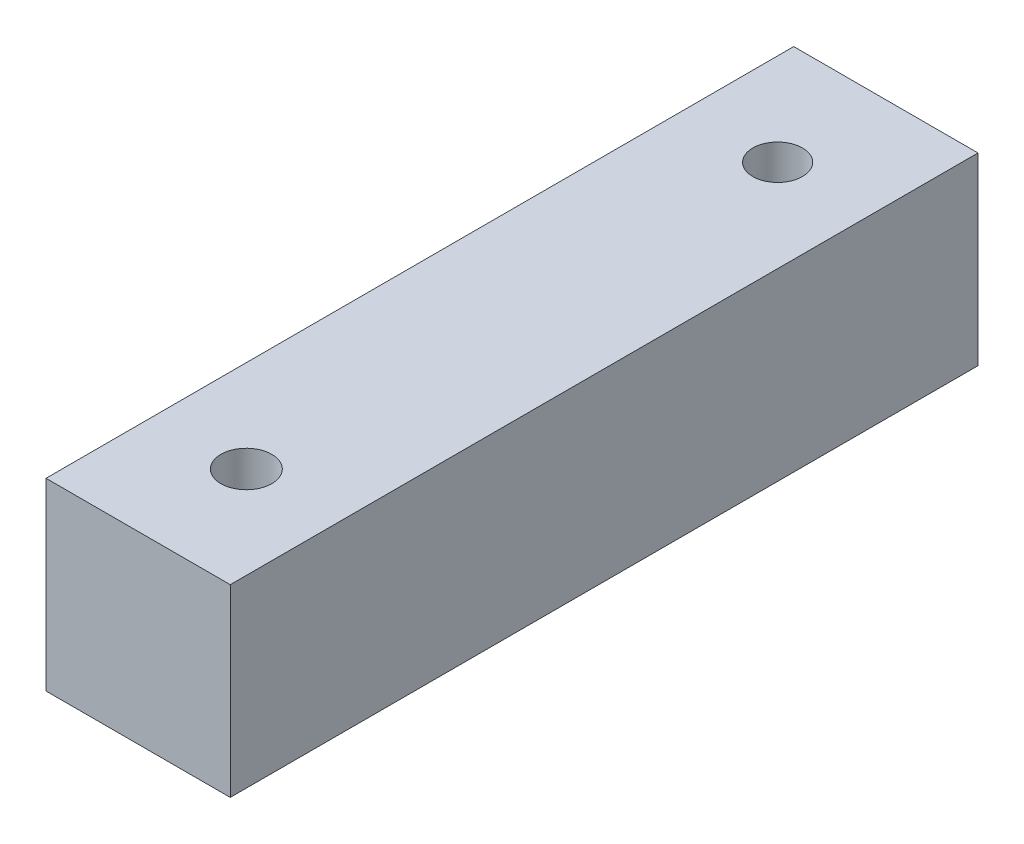
from build123d import *

# Parameters (mm, degrees)
SKETCH1_W           = 12.7
SKETCH1_H           = 12.7
BOSS_EXTRUDE1_DEPTH = 51.53914
SKETCH2_R           = 1.75452968
SKETCH2_R_2         = 1.710055228
CUT_EXTRUDE1_DEPTH  = 54.459287799


with BuildPart() as part:
    # Sketch1 → Boss-Extrude1 (new body)
    with BuildSketch(Plane.XY):
        Rectangle(SKETCH1_W, SKETCH1_H)
    extrude(amount=BOSS_EXTRUDE1_DEPTH)

    # Sketch2 → Cut-Extrude1 (cut, through all)
    with BuildSketch(Plane.XZ.offset(6.35)):
        with Locations((0, 44.08043)):
            Circle(SKETCH2_R)
        with Locations((0, 7.46125)):
            Circle(SKETCH2_R_2)
    extrude(amount=-CUT_EXTRUDE1_DEPTH, mode=Mode.SUBTRACT)


solid = part.part
